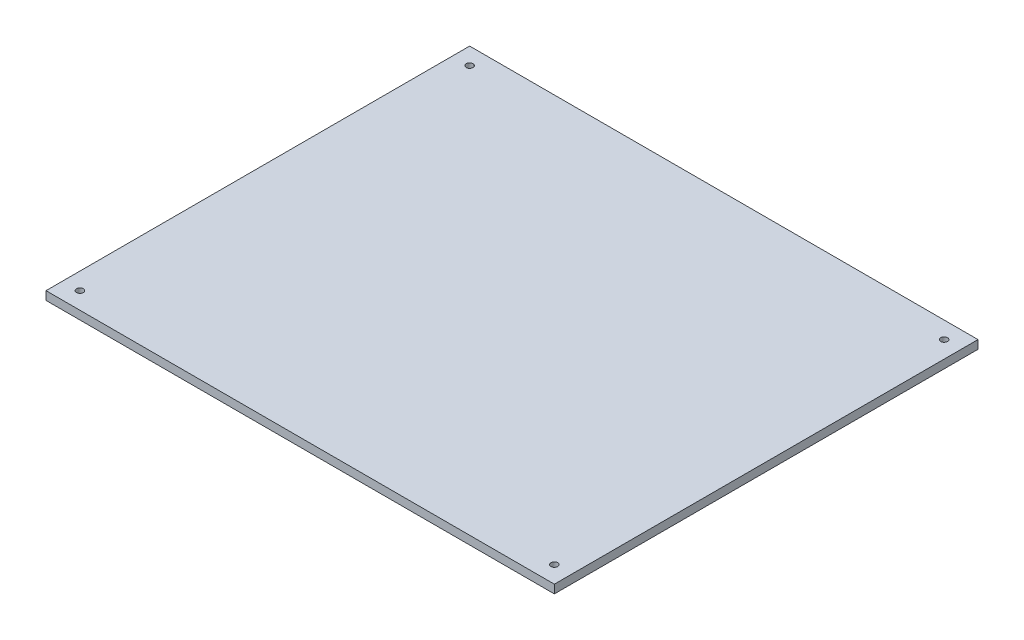
from build123d import *

# Parameters (mm, degrees)
SKETCH1_W           = 300
SKETCH1_H           = 250
SKETCH1_R           = 2
BOSS_EXTRUDE1_DEPTH = 5


with BuildPart() as part:
    # Sketch1 → Boss-Extrude1 (new body)
    with BuildSketch(Plane(origin=(0, 0, 0), x_dir=(1, 0, 0), z_dir=(0, 1, 0))):
        Rectangle(SKETCH1_W, SKETCH1_H)
        with Locations((-140, -115)):
            Circle(SKETCH1_R, mode=Mode.SUBTRACT)
        with Locations((-140, 115)):
            Circle(SKETCH1_R, mode=Mode.SUBTRACT)
        with Locations((140, -115)):
            Circle(SKETCH1_R, mode=Mode.SUBTRACT)
        with Locations((140, 115)):
            Circle(SKETCH1_R, mode=Mode.SUBTRACT)
    extrude(amount=BOSS_EXTRUDE1_DEPTH)


solid = part.part
